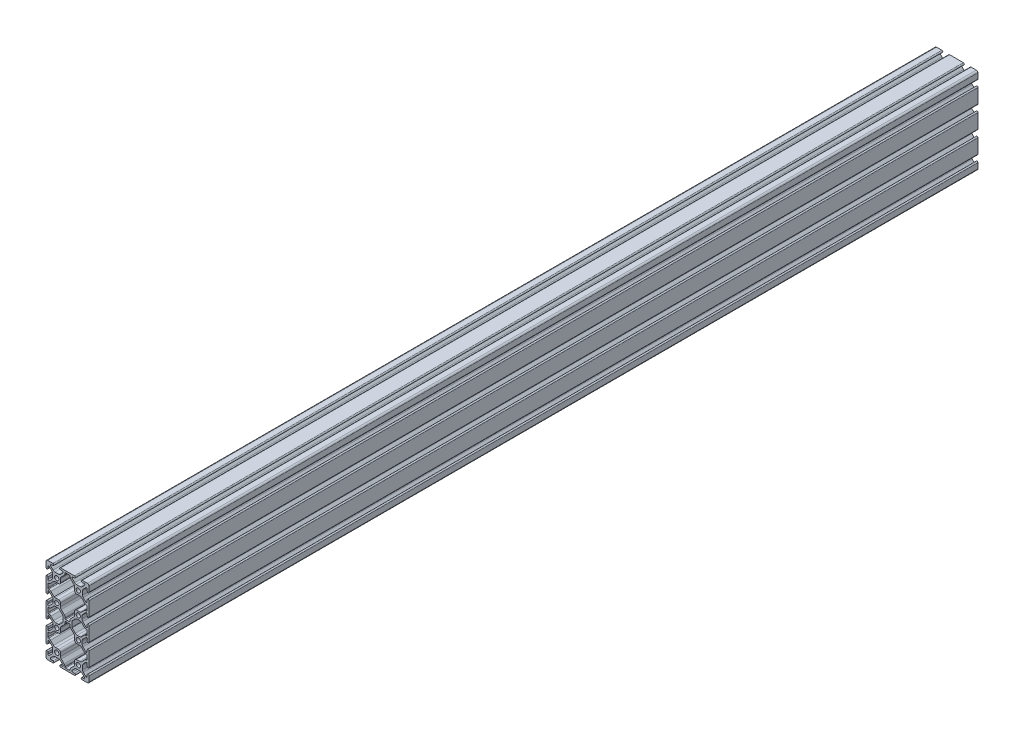
from build123d import *

# Parameters (mm, degrees)
SKETCH1_R      = 2.5
EXTRUDE1_DEPTH = 1031.698


with BuildPart() as part:
    # Sketch1 → Extrude1 (new body)
    with BuildSketch(Plane.XY):
        with BuildLine():
            Line((-8.202452575, 43.310755937), (-5.238252772, 46.27495574))
            ThreePointArc((-5.238252772, 46.27495574), (-5.03697983, 47.286823153), (-5.894799602, 47.86))
            Line((-5.894799602, 47.86), (-8.02436974, 47.86))
            ThreePointArc((-8.02436974, 47.86), (-9.09436974, 48.93), (-8.02436974, 50))
            Line((-8.02436974, 50), (-2.315834377, 50))
            Line((-2.315834377, 50), (2.315834377, 50))
            Line((2.315834377, 50), (8.02436974, 50))
            ThreePointArc((8.02436974, 50), (9.09436974, 48.93), (8.02436974, 47.86))
            Line((8.02436974, 47.86), (5.894799602, 47.86))
            ThreePointArc((5.894799602, 47.86), (5.03697983, 47.286823153), (5.238252772, 46.27495574))
            Line((5.238252772, 46.27495574), (8.202452575, 43.310755937))
            ThreePointArc((8.202452575, 43.310755937), (9.157595011, 42.672550862), (10.284262293, 42.448444577))
            Line((10.284262293, 42.448444577), (14.708234998, 42.448454152))
            ThreePointArc((14.708234998, 42.448454152), (15.83893827, 42.671117491), (16.797547425, 43.310755937))
            Line((16.797547425, 43.310755937), (19.761747228, 46.27495574))
            ThreePointArc((19.761747228, 46.27495574), (19.96302017, 47.286823153), (19.105200398, 47.86))
            Line((19.105200398, 47.86), (16.97563026, 47.86))
            ThreePointArc((16.97563026, 47.86), (15.90563026, 48.93), (16.97563026, 50))
            Line((16.97563026, 50), (21.758832238, 50))
            Line((21.758832238, 50), (23.041124805, 50))
            ThreePointArc((23.041124805, 50), (24.332005248, 49.521885571), (25, 48.318245783))
            Line((25, 48.318245783), (25, 42.082202669))
            ThreePointArc((25, 42.082202669), (23.93, 41.012202669), (22.86, 42.082202669))
            Line((22.86, 42.082202669), (22.86, 44.211772807))
            ThreePointArc((22.86, 44.211772807), (22.13773437, 44.916244594), (21.164272753, 44.651064241))
            Line((21.164272753, 44.651064241), (18.327918757, 41.814710246))
            ThreePointArc((18.327918757, 41.814710246), (17.639489034, 40.784402354), (17.397744663, 39.569071332))
            Line((17.397744663, 39.569071332), (17.397744663, 35.430928668))
            ThreePointArc((17.397744663, 35.430928668), (17.639489034, 34.215597646), (18.327918757, 33.185289754))
            Line((18.327918757, 33.185289754), (21.127116553, 30.386091959))
            ThreePointArc((21.127116553, 30.386091959), (22.233362186, 30.166046021), (22.86, 31.103875784))
            Line((22.86, 31.103875784), (22.86, 33.442202669))
            ThreePointArc((22.86, 33.442202669), (23.93, 34.512202669), (25, 33.442202669))
            Line((25, 33.442202669), (25, 29.299008941))
            Line((25, 29.299008941), (25, 21.219740648))
            Line((25, 21.219740648), (25, 17.040370729))
            ThreePointArc((25, 17.040370729), (23.904333588, 15.955956055), (22.86646371, 17.095809637))
            Line((22.86646371, 17.095809637), (22.86646371, 19.489411218))
            ThreePointArc((22.86646371, 19.489411218), (22.119482528, 20.02126145), (21.24830289, 19.735094378))
            Line((21.24830289, 19.735094378), (17.927013012, 16.4138045))
            ThreePointArc((17.927013012, 16.4138045), (17.222742213, 15.542217138), (16.865021315, 14.480286045))
            Line((16.865021315, 14.480286045), (16.865021315, 11.373754622))
            ThreePointArc((16.865021315, 11.373754622), (17.006264756, 9.974657926), (17.737790465, 8.77370355))
            Line((17.737790465, 8.77370355), (21.060805533, 5.450688482))
            ThreePointArc((21.060805533, 5.450688482), (22.48261952, 5.067456017), (22.865851985, 6.489270005))
            Line((22.865851985, 6.489270005), (22.865851985, 8.266111582))
            ThreePointArc((22.865851985, 8.266111582), (23.927171289, 9.338940293), (25, 8.277620989))
            Line((25, 8.277620989), (25, 3.7699517))
            Line((25, 3.7699517), (25, -3.7699517))
            Line((25, -3.7699517), (25, -8.277620989))
            ThreePointArc((25, -8.277620989), (23.927171289, -9.338940293), (22.865851985, -8.266111582))
            Line((22.865851985, -8.266111582), (22.865851985, -6.489270005))
            ThreePointArc((22.865851985, -6.489270005), (22.48261952, -5.067456017), (21.060805533, -5.450688482))
            Line((21.060805533, -5.450688482), (17.737790465, -8.77370355))
            ThreePointArc((17.737790465, -8.77370355), (17.006264756, -9.974657926), (16.865021315, -11.373754622))
            Line((16.865021315, -11.373754622), (16.865021315, -14.480286045))
            ThreePointArc((16.865021315, -14.480286045), (17.222742213, -15.542217138), (17.927013012, -16.4138045))
            Line((17.927013012, -16.4138045), (21.24830289, -19.735094378))
            ThreePointArc((21.24830289, -19.735094378), (22.119482528, -20.02126145), (22.86646371, -19.489411218))
            Line((22.86646371, -19.489411218), (22.86646371, -17.095809637))
            ThreePointArc((22.86646371, -17.095809637), (23.904333588, -15.955956055), (25, -17.040370729))
            Line((25, -17.040370729), (25, -21.219740648))
            Line((25, -21.219740648), (25, -29.299008941))
            Line((25, -29.299008941), (25, -33.442202669))
            ThreePointArc((25, -33.442202669), (23.93, -34.512202669), (22.86, -33.442202669))
            Line((22.86, -33.442202669), (22.86, -31.103875784))
            ThreePointArc((22.86, -31.103875784), (22.233362186, -30.166046021), (21.127116553, -30.386091959))
            Line((21.127116553, -30.386091959), (18.327918757, -33.185289754))
            ThreePointArc((18.327918757, -33.185289754), (17.639489034, -34.215597646), (17.397744663, -35.430928668))
            Line((17.397744663, -35.430928668), (17.397744663, -39.569071332))
            ThreePointArc((17.397744663, -39.569071332), (17.639489034, -40.784402354), (18.327918757, -41.814710246))
            Line((18.327918757, -41.814710246), (21.164272753, -44.651064241))
            ThreePointArc((21.164272753, -44.651064241), (22.13773437, -44.916244594), (22.86, -44.211772807))
            Line((22.86, -44.211772807), (22.86, -42.082202669))
            ThreePointArc((22.86, -42.082202669), (23.93, -41.012202669), (25, -42.082202669))
            Line((25, -42.082202669), (25, -48.318245783))
            ThreePointArc((25, -48.318245783), (24.332005248, -49.521885571), (23.041124805, -50))
            Line((23.041124805, -50), (21.758832238, -50))
            Line((21.758832238, -50), (16.97563026, -50))
            ThreePointArc((16.97563026, -50), (15.90563026, -48.93), (16.97563026, -47.86))
            Line((16.97563026, -47.86), (19.105200398, -47.86))
            ThreePointArc((19.105200398, -47.86), (19.96302017, -47.286823153), (19.761747228, -46.27495574))
            Line((19.761747228, -46.27495574), (16.797547425, -43.310755937))
            ThreePointArc((16.797547425, -43.310755937), (15.83893827, -42.671117491), (14.708234998, -42.448454152))
            Line((14.708234998, -42.448454152), (10.284262293, -42.448444577))
            ThreePointArc((10.284262293, -42.448444577), (9.157595011, -42.672550862), (8.202452575, -43.310755937))
            Line((8.202452575, -43.310755937), (5.238252772, -46.27495574))
            ThreePointArc((5.238252772, -46.27495574), (5.03697983, -47.286823153), (5.894799602, -47.86))
            Line((5.894799602, -47.86), (8.02436974, -47.86))
            ThreePointArc((8.02436974, -47.86), (9.09436974, -48.93), (8.02436974, -50))
            Line((8.02436974, -50), (2.315834377, -50))
            Line((2.315834377, -50), (-2.315834377, -50))
            Line((-2.315834377, -50), (-8.02436974, -50))
            ThreePointArc((-8.02436974, -50), (-9.09436974, -48.93), (-8.02436974, -47.86))
            Line((-8.02436974, -47.86), (-5.894799602, -47.86))
            ThreePointArc((-5.894799602, -47.86), (-5.03697983, -47.286823153), (-5.238252772, -46.27495574))
            Line((-5.238252772, -46.27495574), (-8.202452575, -43.310755937))
            ThreePointArc((-8.202452575, -43.310755937), (-9.157595011, -42.672550862), (-10.284262293, -42.448444577))
            Line((-10.284262293, -42.448444577), (-14.708234998, -42.448454152))
            ThreePointArc((-14.708234998, -42.448454152), (-15.83893827, -42.671117491), (-16.797547425, -43.310755937))
            Line((-16.797547425, -43.310755937), (-19.761747228, -46.27495574))
            ThreePointArc((-19.761747228, -46.27495574), (-19.96302017, -47.286823153), (-19.105200398, -47.86))
            Line((-19.105200398, -47.86), (-16.97563026, -47.86))
            ThreePointArc((-16.97563026, -47.86), (-15.90563026, -48.93), (-16.97563026, -50))
            Line((-16.97563026, -50), (-23.041124805, -50))
            ThreePointArc((-23.041124805, -50), (-24.332005248, -49.521885571), (-25, -48.318245783))
            Line((-25, -48.318245783), (-25, -42.082202669))
            ThreePointArc((-25, -42.082202669), (-23.93, -41.012202669), (-22.86, -42.082202669))
            Line((-22.86, -42.082202669), (-22.86, -44.211772807))
            ThreePointArc((-22.86, -44.211772807), (-22.13773437, -44.916244594), (-21.164272753, -44.651064241))
            Line((-21.164272753, -44.651064241), (-18.327918757, -41.814710246))
            ThreePointArc((-18.327918757, -41.814710246), (-17.639489034, -40.784402354), (-17.397744663, -39.569071332))
            Line((-17.397744663, -39.569071332), (-17.397744663, -35.430928668))
            ThreePointArc((-17.397744663, -35.430928668), (-17.639489034, -34.215597646), (-18.327918757, -33.185289754))
            Line((-18.327918757, -33.185289754), (-21.127116553, -30.386091959))
            ThreePointArc((-21.127116553, -30.386091959), (-22.233362186, -30.166046021), (-22.86, -31.103875784))
            Line((-22.86, -31.103875784), (-22.86, -33.442202669))
            ThreePointArc((-22.86, -33.442202669), (-23.93, -34.512202669), (-25, -33.442202669))
            Line((-25, -33.442202669), (-25, -29.299008941))
            Line((-25, -29.299008941), (-25, -21.219740648))
            Line((-25, -21.219740648), (-25, -17.040370729))
            ThreePointArc((-25, -17.040370729), (-23.904333588, -15.955956055), (-22.86646371, -17.095809637))
            Line((-22.86646371, -17.095809637), (-22.86646371, -19.489411218))
            ThreePointArc((-22.86646371, -19.489411218), (-22.119482528, -20.02126145), (-21.24830289, -19.735094378))
            Line((-21.24830289, -19.735094378), (-17.927013012, -16.4138045))
            ThreePointArc((-17.927013012, -16.4138045), (-17.222742213, -15.542217138), (-16.865021315, -14.480286045))
            Line((-16.865021315, -14.480286045), (-16.865021315, -11.373754622))
            ThreePointArc((-16.865021315, -11.373754622), (-17.006264756, -9.974657926), (-17.737790465, -8.77370355))
            Line((-17.737790465, -8.77370355), (-21.060805533, -5.450688482))
            ThreePointArc((-21.060805533, -5.450688482), (-22.48261952, -5.067456017), (-22.865851985, -6.489270005))
            Line((-22.865851985, -6.489270005), (-22.865851985, -8.266111582))
            ThreePointArc((-22.865851985, -8.266111582), (-23.927171289, -9.338940293), (-25, -8.277620989))
            Line((-25, -8.277620989), (-25, -3.7699517))
            Line((-25, -3.7699517), (-25, 3.7699517))
            Line((-25, 3.7699517), (-25, 8.277620989))
            ThreePointArc((-25, 8.277620989), (-23.927171289, 9.338940293), (-22.865851985, 8.266111582))
            Line((-22.865851985, 8.266111582), (-22.865851985, 6.489270005))
            ThreePointArc((-22.865851985, 6.489270005), (-22.48261952, 5.067456017), (-21.060805533, 5.450688482))
            Line((-21.060805533, 5.450688482), (-17.737790465, 8.77370355))
            ThreePointArc((-17.737790465, 8.77370355), (-17.006264756, 9.974657926), (-16.865021315, 11.373754622))
            Line((-16.865021315, 11.373754622), (-16.865021315, 14.480286045))
            ThreePointArc((-16.865021315, 14.480286045), (-17.222742213, 15.542217138), (-17.927013012, 16.4138045))
            Line((-17.927013012, 16.4138045), (-21.24830289, 19.735094378))
            ThreePointArc((-21.24830289, 19.735094378), (-22.119482528, 20.02126145), (-22.86646371, 19.489411218))
            Line((-22.86646371, 19.489411218), (-22.86646371, 17.095809637))
            ThreePointArc((-22.86646371, 17.095809637), (-23.904333588, 15.955956055), (-25, 17.040370729))
            Line((-25, 17.040370729), (-25, 21.219740648))
            Line((-25, 21.219740648), (-25, 29.299008941))
            Line((-25, 29.299008941), (-25, 33.442202669))
            ThreePointArc((-25, 33.442202669), (-23.93, 34.512202669), (-22.86, 33.442202669))
            Line((-22.86, 33.442202669), (-22.86, 31.103875784))
            ThreePointArc((-22.86, 31.103875784), (-22.233362186, 30.166046021), (-21.127116553, 30.386091959))
            Line((-21.127116553, 30.386091959), (-18.327918757, 33.185289754))
            ThreePointArc((-18.327918757, 33.185289754), (-17.639489034, 34.215597646), (-17.397744663, 35.430928668))
            Line((-17.397744663, 35.430928668), (-17.397744663, 39.569071332))
            ThreePointArc((-17.397744663, 39.569071332), (-17.639489034, 40.784402354), (-18.327918757, 41.814710246))
            Line((-18.327918757, 41.814710246), (-21.164272753, 44.651064241))
            ThreePointArc((-21.164272753, 44.651064241), (-22.13773437, 44.916244594), (-22.86, 44.211772807))
            Line((-22.86, 44.211772807), (-22.86, 42.082202669))
            ThreePointArc((-22.86, 42.082202669), (-23.93, 41.012202669), (-25, 42.082202669))
            Line((-25, 42.082202669), (-25, 48.318245783))
            ThreePointArc((-25, 48.318245783), (-24.332005248, 49.521885571), (-23.041124805, 50))
            Line((-23.041124805, 50), (-16.97563026, 50))
            ThreePointArc((-16.97563026, 50), (-15.90563026, 48.93), (-16.97563026, 47.86))
            Line((-16.97563026, 47.86), (-19.105200398, 47.86))
            ThreePointArc((-19.105200398, 47.86), (-19.96302017, 47.286823153), (-19.761747228, 46.27495574))
            Line((-19.761747228, 46.27495574), (-16.797547425, 43.310755937))
            ThreePointArc((-16.797547425, 43.310755937), (-15.83893827, 42.671117491), (-14.708234998, 42.448454152))
            Line((-14.708234998, 42.448454152), (-10.284262293, 42.448444577))
            ThreePointArc((-10.284262293, 42.448444577), (-9.157595011, 42.672550862), (-8.202452575, 43.310755937))
        make_face()
        with Locations((-12.5, 12.5)):
            Circle(SKETCH1_R, mode=Mode.SUBTRACT)
        with Locations((-12.5, 37.5)):
            Circle(SKETCH1_R, mode=Mode.SUBTRACT)
        with Locations((12.5, -12.5)):
            Circle(SKETCH1_R, mode=Mode.SUBTRACT)
        with Locations((12.5, -37.5)):
            Circle(SKETCH1_R, mode=Mode.SUBTRACT)
        with Locations((-12.5, -37.5)):
            Circle(SKETCH1_R, mode=Mode.SUBTRACT)
        with Locations((-12.5, -12.5)):
            Circle(SKETCH1_R, mode=Mode.SUBTRACT)
        with Locations((12.5, 37.5)):
            Circle(SKETCH1_R, mode=Mode.SUBTRACT)
        with Locations((12.5, 12.5)):
            Circle(SKETCH1_R, mode=Mode.SUBTRACT)
        with BuildLine():
            Line((-8.185773444, 12.487513796), (-8.185773444, 11.011393555))
            ThreePointArc((-8.185773444, 11.011393555), (-8.008609194, 9.643792267), (-7.268461542, 8.480219361))
            Line((-7.268461542, 8.480219361), (-3.754938975, 4.966696794))
            ThreePointArc((-3.754938975, 4.966696794), (-3.063534403, 3.923946022), (-2.832523582, 2.694310526))
            Line((-2.832523582, 2.694310526), (-2.832523582, 1.819708918))
            ThreePointArc((-2.832523582, 1.819708918), (-2.609281799, 1.280755579), (-2.07032846, 1.057513796))
            Line((-2.07032846, 1.057513796), (2.072320044, 1.057513796))
            ThreePointArc((2.072320044, 1.057513796), (2.611273383, 1.280755579), (2.834515166, 1.819708918))
            Line((2.834515166, 1.819708918), (2.834515166, 2.694310526))
            ThreePointArc((2.834515166, 2.694310526), (3.065525987, 3.923946022), (3.756930558, 4.966696794))
            Line((3.756930558, 4.966696794), (7.270453125, 8.480219361))
            ThreePointArc((7.270453125, 8.480219361), (8.010600778, 9.643792267), (8.187765028, 11.011393555))
            Line((8.187765028, 11.011393555), (8.187765028, 14.589100627))
            ThreePointArc((8.187765028, 14.589100627), (8.835059042, 16.151806613), (10.397765028, 16.799100627))
            Line((10.397765028, 16.799100627), (14.322526745, 16.799100627))
            ThreePointArc((14.322526745, 16.799100627), (14.978333775, 16.883638222), (15.602419985, 17.102146501))
            Line((15.602419985, 17.102146501), (19.298207918, 20.797934434))
            ThreePointArc((19.298207918, 20.797934434), (20.326629934, 21.485104056), (21.539736414, 21.726405938))
            Line((21.539736414, 21.726405938), (22.112655364, 21.726405938))
            ThreePointArc((22.112655364, 21.726405938), (22.651608703, 21.94964772), (22.874850486, 22.488601059))
            Line((22.874850486, 22.488601059), (22.874850486, 26.856767325))
            ThreePointArc((22.874850486, 26.856767325), (22.653840578, 27.386829201), (22.125606626, 27.612173081))
            Line((22.125606626, 27.612173081), (21.871541586, 27.612173081))
            ThreePointArc((21.871541586, 27.612173081), (20.717547023, 27.958593442), (19.776177785, 28.710613704))
            Line((19.776177785, 28.710613704), (16.387363346, 32.099428142))
            ThreePointArc((16.387363346, 32.099428142), (15.195987364, 32.790442646), (13.839798728, 33.030505467))
            Line((13.839798728, 33.030505467), (10.362350257, 33.030505467))
            ThreePointArc((10.362350257, 33.030505467), (8.799644271, 33.67779948), (8.152350257, 35.240505467))
            Line((8.152350257, 35.240505467), (8.152350257, 39.051208905))
            ThreePointArc((8.152350257, 39.051208905), (7.904533851, 40.249092372), (7.222341418, 41.26445007))
            Line((7.222341418, 41.26445007), (4.012209831, 44.474581658))
            ThreePointArc((4.012209831, 44.474581658), (3.329287545, 45.496647086), (3.089477129, 46.70225546))
            Line((3.089477129, 46.70225546), (3.089477129, 47.097840517))
            ThreePointArc((3.089477129, 47.097840517), (2.866245785, 47.636768656), (2.327317646, 47.86))
            Line((2.327317646, 47.86), (0, 47.86))
            Line((0, 47.86), (-2.327317646, 47.86))
            ThreePointArc((-2.327317646, 47.86), (-2.866245785, 47.636768656), (-3.089477129, 47.097840517))
            Line((-3.089477129, 47.097840517), (-3.089477129, 46.70225546))
            ThreePointArc((-3.089477129, 46.70225546), (-3.329287545, 45.496647086), (-4.012209831, 44.474581658))
            Line((-4.012209831, 44.474581658), (-7.222341418, 41.26445007))
            ThreePointArc((-7.222341418, 41.26445007), (-7.904533851, 40.249092372), (-8.152350257, 39.051208905))
            Line((-8.152350257, 39.051208905), (-8.152350257, 35.240505467))
            ThreePointArc((-8.152350257, 35.240505467), (-8.799644271, 33.67779948), (-10.362350257, 33.030505467))
            Line((-10.362350257, 33.030505467), (-10.389864765, 33.030505467))
            Line((-10.389864765, 33.030505467), (-13.839798728, 33.030505467))
            ThreePointArc((-13.839798728, 33.030505467), (-15.195987364, 32.790442646), (-16.387363346, 32.099428142))
            Line((-16.387363346, 32.099428142), (-19.776177785, 28.710613704))
            ThreePointArc((-19.776177785, 28.710613704), (-20.711520847, 27.964936369), (-21.856598739, 27.618962447))
            Line((-21.856598739, 27.618962447), (-22.11066378, 27.618962447))
            ThreePointArc((-22.11066378, 27.618962447), (-22.649617119, 27.395720665), (-22.872858902, 26.856767325))
            Line((-22.872858902, 26.856767325), (-22.872858902, 22.488601059))
            ThreePointArc((-22.872858902, 22.488601059), (-22.649617119, 21.94964772), (-22.11066378, 21.726405938))
            Line((-22.11066378, 21.726405938), (-21.537744831, 21.726405938))
            ThreePointArc((-21.537744831, 21.726405938), (-20.32463835, 21.485104056), (-19.296216334, 20.797934434))
            Line((-19.296216334, 20.797934434), (-15.600428402, 17.102146501))
            ThreePointArc((-15.600428402, 17.102146501), (-14.976342192, 16.883638222), (-14.320535162, 16.799100627))
            Line((-14.320535162, 16.799100627), (-10.395773444, 16.799100627))
            ThreePointArc((-10.395773444, 16.799100627), (-8.833067458, 16.151806613), (-8.185773444, 14.589100627))
            Line((-8.185773444, 14.589100627), (-8.185773444, 12.487513796))
        make_face(mode=Mode.SUBTRACT)
        with BuildLine():
            Line((-22.86, 2.484036233), (-22.86, -2.484036233))
            ThreePointArc((-22.86, -2.484036233), (-22.636758217, -3.022989573), (-22.097804878, -3.246231355))
            Line((-22.097804878, -3.246231355), (-21.843739837, -3.246231355))
            ThreePointArc((-21.843739837, -3.246231355), (-20.485171192, -3.421032102), (-19.329200619, -4.155876372))
            Line((-19.329200619, -4.155876372), (-16.293050967, -7.192026025))
            ThreePointArc((-16.293050967, -7.192026025), (-15.262743076, -7.880455748), (-14.047412053, -8.122200119))
            Line((-14.047412053, -8.122200119), (-11.24083373, -8.122200119))
            ThreePointArc((-11.24083373, -8.122200119), (-10.025502708, -7.880455748), (-8.995194816, -7.192026025))
            Line((-8.995194816, -7.192026025), (-5.327964206, -3.524795414))
            ThreePointArc((-5.327964206, -3.524795414), (-5.186657366, -3.313314782), (-5.137037002, -3.063856368))
            Line((-5.137037002, -3.063856368), (-5.137037002, 3.063856368))
            ThreePointArc((-5.137037002, 3.063856368), (-5.186657366, 3.313314782), (-5.327964206, 3.524795414))
            Line((-5.327964206, 3.524795414), (-8.995194816, 7.192026025))
            ThreePointArc((-8.995194816, 7.192026025), (-10.025502708, 7.880455748), (-11.24083373, 8.122200119))
            Line((-11.24083373, 8.122200119), (-14.047412053, 8.122200119))
            ThreePointArc((-14.047412053, 8.122200119), (-15.262743076, 7.880455748), (-16.293050967, 7.192026025))
            Line((-16.293050967, 7.192026025), (-19.329200619, 4.155876372))
            ThreePointArc((-19.329200619, 4.155876372), (-20.485171192, 3.421032102), (-21.843739837, 3.246231355))
            Line((-21.843739837, 3.246231355), (-22.097804878, 3.246231355))
            ThreePointArc((-22.097804878, 3.246231355), (-22.636758217, 3.022989573), (-22.86, 2.484036233))
        make_face(mode=Mode.SUBTRACT)
        with BuildLine():
            Line((5.137037002, 3.063856368), (5.137037002, -3.063856368))
            ThreePointArc((5.137037002, -3.063856368), (5.186657366, -3.313314782), (5.327964206, -3.524795414))
            Line((5.327964206, -3.524795414), (8.995194816, -7.192026025))
            ThreePointArc((8.995194816, -7.192026025), (10.025502708, -7.880455748), (11.24083373, -8.122200119))
            Line((11.24083373, -8.122200119), (14.047412053, -8.122200119))
            ThreePointArc((14.047412053, -8.122200119), (15.262743076, -7.880455748), (16.293050967, -7.192026025))
            Line((16.293050967, -7.192026025), (19.329200619, -4.155876372))
            ThreePointArc((19.329200619, -4.155876372), (20.485171192, -3.421032102), (21.843739837, -3.246231355))
            Line((21.843739837, -3.246231355), (22.097804878, -3.246231355))
            ThreePointArc((22.097804878, -3.246231355), (22.636758217, -3.022989573), (22.86, -2.484036233))
            Line((22.86, -2.484036233), (22.86, 2.484036233))
            ThreePointArc((22.86, 2.484036233), (22.636758217, 3.022989573), (22.097804878, 3.246231355))
            Line((22.097804878, 3.246231355), (21.843739837, 3.246231355))
            ThreePointArc((21.843739837, 3.246231355), (20.485171192, 3.421032102), (19.329200619, 4.155876372))
            Line((19.329200619, 4.155876372), (16.293050967, 7.192026025))
            ThreePointArc((16.293050967, 7.192026025), (15.262743076, 7.880455748), (14.047412053, 8.122200119))
            Line((14.047412053, 8.122200119), (11.24083373, 8.122200119))
            ThreePointArc((11.24083373, 8.122200119), (10.025502708, 7.880455748), (8.995194816, 7.192026025))
            Line((8.995194816, 7.192026025), (5.327964206, 3.524795414))
            ThreePointArc((5.327964206, 3.524795414), (5.186657366, 3.313314782), (5.137037002, 3.063856368))
        make_face(mode=Mode.SUBTRACT)
        with BuildLine():
            Line((-2.832523582, -2.694310526), (-2.832523582, -1.819708918))
            ThreePointArc((-2.832523582, -1.819708918), (-2.609281799, -1.280755579), (-2.07032846, -1.057513796))
            Line((-2.07032846, -1.057513796), (2.072320044, -1.057513796))
            ThreePointArc((2.072320044, -1.057513796), (2.611273383, -1.280755579), (2.834515166, -1.819708918))
            Line((2.834515166, -1.819708918), (2.834515166, -2.694310526))
            ThreePointArc((2.834515166, -2.694310526), (3.065525987, -3.923946022), (3.756930558, -4.966696794))
            Line((3.756930558, -4.966696794), (7.270453125, -8.480219361))
            ThreePointArc((7.270453125, -8.480219361), (8.010600778, -9.643792267), (8.187765028, -11.011393555))
            Line((8.187765028, -11.011393555), (8.187765028, -14.589100627))
            ThreePointArc((8.187765028, -14.589100627), (8.835059042, -16.151806613), (10.397765028, -16.799100627))
            Line((10.397765028, -16.799100627), (14.322526745, -16.799100627))
            ThreePointArc((14.322526745, -16.799100627), (14.978333775, -16.883638222), (15.602419985, -17.102146501))
            Line((15.602419985, -17.102146501), (19.298207918, -20.797934434))
            ThreePointArc((19.298207918, -20.797934434), (20.326629934, -21.485104056), (21.539736414, -21.726405938))
            Line((21.539736414, -21.726405938), (22.112655364, -21.726405938))
            ThreePointArc((22.112655364, -21.726405938), (22.651608703, -21.94964772), (22.874850486, -22.488601059))
            Line((22.874850486, -22.488601059), (22.874850486, -26.856767325))
            ThreePointArc((22.874850486, -26.856767325), (22.653840578, -27.386829201), (22.125606626, -27.612173081))
            Line((22.125606626, -27.612173081), (21.871541586, -27.612173081))
            ThreePointArc((21.871541586, -27.612173081), (20.717547023, -27.958593442), (19.776177785, -28.710613704))
            Line((19.776177785, -28.710613704), (16.387363346, -32.099428142))
            ThreePointArc((16.387363346, -32.099428142), (15.195987364, -32.790442646), (13.839798728, -33.030505467))
            Line((13.839798728, -33.030505467), (10.362350257, -33.030505467))
            ThreePointArc((10.362350257, -33.030505467), (8.799644271, -33.67779948), (8.152350257, -35.240505467))
            Line((8.152350257, -35.240505467), (8.152350257, -39.051208905))
            ThreePointArc((8.152350257, -39.051208905), (7.904533851, -40.249092372), (7.222341418, -41.26445007))
            Line((7.222341418, -41.26445007), (4.012209831, -44.474581658))
            ThreePointArc((4.012209831, -44.474581658), (3.329287545, -45.496647086), (3.089477129, -46.70225546))
            Line((3.089477129, -46.70225546), (3.089477129, -47.097840517))
            ThreePointArc((3.089477129, -47.097840517), (2.866245785, -47.636768656), (2.327317646, -47.86))
            Line((2.327317646, -47.86), (0, -47.86))
            Line((0, -47.86), (-2.327317646, -47.86))
            ThreePointArc((-2.327317646, -47.86), (-2.866245785, -47.636768656), (-3.089477129, -47.097840517))
            Line((-3.089477129, -47.097840517), (-3.089477129, -46.70225546))
            ThreePointArc((-3.089477129, -46.70225546), (-3.329287545, -45.496647086), (-4.012209831, -44.474581658))
            Line((-4.012209831, -44.474581658), (-7.222341418, -41.26445007))
            ThreePointArc((-7.222341418, -41.26445007), (-7.904533851, -40.249092372), (-8.152350257, -39.051208905))
            Line((-8.152350257, -39.051208905), (-8.152350257, -35.240505467))
            ThreePointArc((-8.152350257, -35.240505467), (-8.799644271, -33.67779948), (-10.362350257, -33.030505467))
            Line((-10.362350257, -33.030505467), (-10.389864765, -33.030505467))
            Line((-10.389864765, -33.030505467), (-13.839798728, -33.030505467))
            ThreePointArc((-13.839798728, -33.030505467), (-15.195987364, -32.790442646), (-16.387363346, -32.099428142))
            Line((-16.387363346, -32.099428142), (-19.776177785, -28.710613704))
            ThreePointArc((-19.776177785, -28.710613704), (-20.711520847, -27.964936369), (-21.856598739, -27.618962447))
            Line((-21.856598739, -27.618962447), (-22.11066378, -27.618962447))
            ThreePointArc((-22.11066378, -27.618962447), (-22.649617119, -27.395720665), (-22.872858902, -26.856767325))
            Line((-22.872858902, -26.856767325), (-22.872858902, -22.488601059))
            ThreePointArc((-22.872858902, -22.488601059), (-22.649617119, -21.94964772), (-22.11066378, -21.726405938))
            Line((-22.11066378, -21.726405938), (-21.537744831, -21.726405938))
            ThreePointArc((-21.537744831, -21.726405938), (-20.32463835, -21.485104056), (-19.296216334, -20.797934434))
            Line((-19.296216334, -20.797934434), (-15.600428402, -17.102146501))
            ThreePointArc((-15.600428402, -17.102146501), (-14.976342192, -16.883638222), (-14.320535162, -16.799100627))
            Line((-14.320535162, -16.799100627), (-10.395773444, -16.799100627))
            ThreePointArc((-10.395773444, -16.799100627), (-8.833067458, -16.151806613), (-8.185773444, -14.589100627))
            Line((-8.185773444, -14.589100627), (-8.185773444, -12.487513796))
            Line((-8.185773444, -12.487513796), (-8.185773444, -11.011393555))
            ThreePointArc((-8.185773444, -11.011393555), (-8.008609194, -9.643792267), (-7.268461542, -8.480219361))
            Line((-7.268461542, -8.480219361), (-3.754938975, -4.966696794))
            ThreePointArc((-3.754938975, -4.966696794), (-3.063534403, -3.923946022), (-2.832523582, -2.694310526))
        make_face(mode=Mode.SUBTRACT)
    extrude(amount=-EXTRUDE1_DEPTH)


solid = part.part
